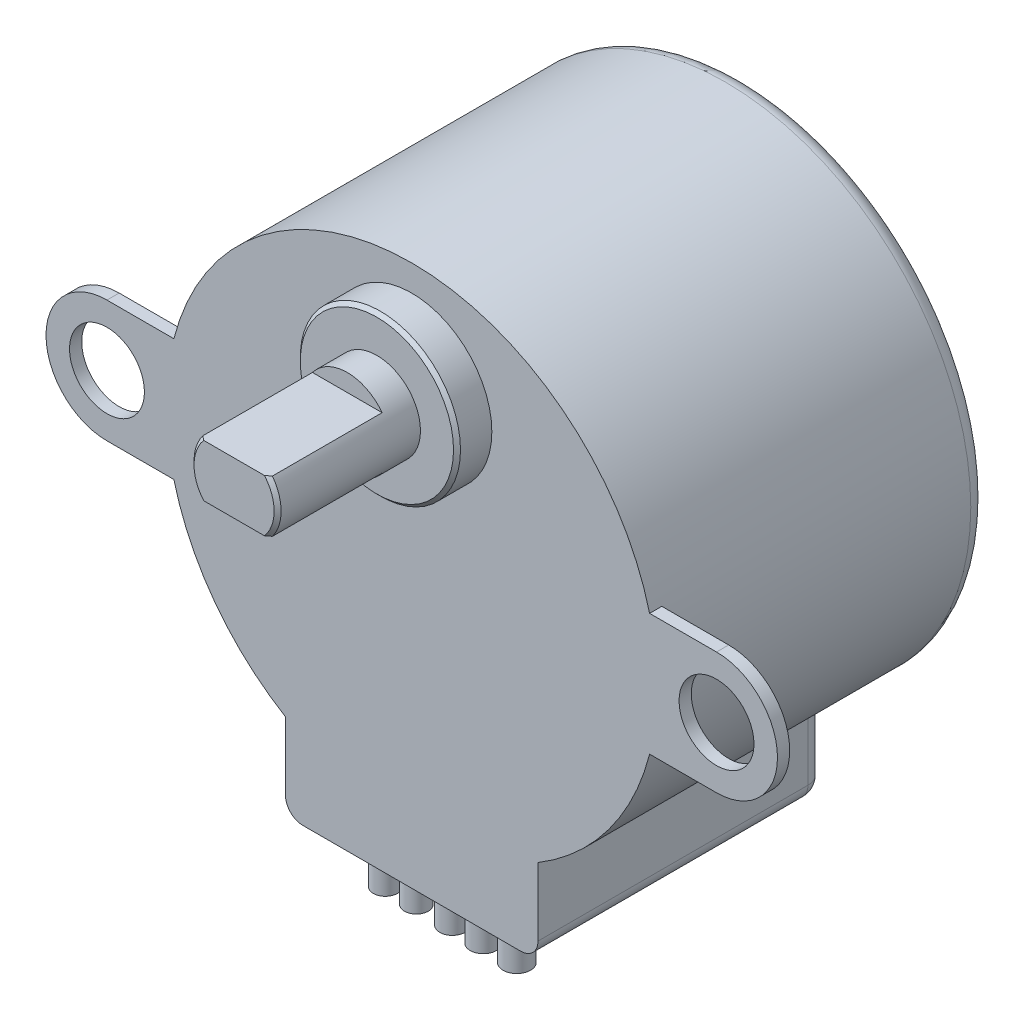
from build123d import *

# Parameters (mm, degrees)
SKETCH_1_R          = 14.1
EXTRUDE_1_DEPTH     = 19
SKETCH_2_R          = 2.15
EXTRUDE_2_DEPTH     = 0.7
FILLET_1_R          = 1
SKETCH_3_R          = 4.6
EXTRUDE_3_DEPTH     = 2
SKETCH_4_R          = 2.5
EXTRUDE_4_DEPTH     = 8.2
CUT_EXTRUDE_START   = -6.5
CUT_EXTRUDE_1_DEPTH = 6.5
CHAMFER_1_SIZE      = 0.2
EXTRUDE_START       = -16.5
EXTRUDE_5_DEPTH     = 16.5
FILLET_2_R          = 1
SKETCH_7_R          = 0.693296655
SKETCH_7_R_2        = 0.683224013
SKETCH_7_R_3        = 0.721072107
SKETCH_7_R_4        = 0.752437583
SKETCH_7_R_5        = 0.788430792
EXTRUDE_6_DEPTH     = 3


with BuildPart() as part:
    # 草图1 → 凸台-拉伸1 (new body)
    with BuildSketch(Plane.XY):
        Circle(SKETCH_1_R)
    extrude(amount=EXTRUDE_1_DEPTH)

    # 草图2 → 凸台-拉伸2 (add)
    with BuildSketch(Plane.XY.offset(19)):
        with BuildLine():
            Line((-17.5, 3.5), (17.5, 3.5))
            ThreePointArc((17.5, 3.5), (21, 0), (17.5, -3.5))
            Line((17.5, -3.5), (-17.5, -3.5))
            ThreePointArc((-17.5, -3.5), (-21, 0), (-17.5, 3.5))
        make_face()
        with Locations((-17.5, 0)):
            Circle(SKETCH_2_R, mode=Mode.SUBTRACT)
        with Locations((17.5, 0)):
            Circle(SKETCH_2_R, mode=Mode.SUBTRACT)
    extrude(amount=-EXTRUDE_2_DEPTH)

    # 圆角1
    fillet_1_edges = [part.edges().sort_by_distance(p)[0] for p in [
        (-14.1, 0, 0),
    ]]
    fillet(fillet_1_edges, radius=FILLET_1_R)

    # 草图3 → 凸台-拉伸3 (add)
    with BuildSketch(Plane.XY.offset(19)):
        with Locations((0, 8)):
            Circle(SKETCH_3_R)
    extrude(amount=EXTRUDE_3_DEPTH)

    # 草图4 → 凸台-拉伸4 (add)
    with BuildSketch(Plane.XY.offset(21)):
        with Locations((0, 8)):
            Circle(SKETCH_4_R)
    extrude(amount=EXTRUDE_4_DEPTH)

    # 草图5 → 切除-拉伸1 (cut)
    with BuildSketch(Plane.XY.offset(29.2).offset(CUT_EXTRUDE_START)):
        with BuildLine():
            Line((-2, 9.5), (2, 9.5))
            ThreePointArc((2, 9.5), (0, 10.5), (-2, 9.5))
        make_face()
        with BuildLine():
            Line((-2, 6.5), (2, 6.5))
            ThreePointArc((2, 6.5), (0, 5.5), (-2, 6.5))
        make_face()
    extrude(amount=CUT_EXTRUDE_1_DEPTH, mode=Mode.SUBTRACT)

    # 倒角1
    chamfer_1_edges = [part.edges().sort_by_distance(p)[0] for p in [
        (2.371708245, 8.790569415, 29.2),
        (-2.5, 8, 29.2),
        (-4.6, 8, 21),
    ]]
    chamfer(chamfer_1_edges, length=CHAMFER_1_SIZE)

    # 草图6 → 凸台-拉伸5 (add)
    with BuildSketch(Plane.XY.offset(19).offset(EXTRUDE_START)):
        with BuildLine():
            Line((-7.25, -12.09328326), (-7.25, -17))
            Line((-7.25, -17), (7.25, -17))
            Line((7.25, -17), (7.25, -12.09328326))
            ThreePointArc((7.25, -12.09328326), (0, -14.1), (-7.25, -12.09328326))
        make_face()
    extrude(amount=EXTRUDE_5_DEPTH)

    # 圆角2
    fillet_2_edges = [part.edges().sort_by_distance(p)[0] for p in [
        (7.25, -17, 10.75),
        (7.25, -14.54664163, 2.5),
        (0, -17, 2.5),
        (-7.25, -17, 10.75),
        (-7.25, -14.54664163, 2.5),
    ]]
    fillet(fillet_2_edges, radius=FILLET_2_R)

    # 草图7 → 凸台-拉伸6 (add)
    with BuildSketch(Plane.XZ.offset(17)):
        with Locations((-3.845717905, 16.667073374)):
            Circle(SKETCH_7_R)
        with Locations((-2.067073374, 16.667073374)):
            Circle(SKETCH_7_R_2)
        with Locations((0, 16.667073374)):
            Circle(SKETCH_7_R_3)
        with Locations((1.778644531, 16.667073374)):
            Circle(SKETCH_7_R_4)
        with Locations((3.701503484, 16.667073374)):
            Circle(SKETCH_7_R_5)
    extrude(amount=EXTRUDE_6_DEPTH)


solid = part.part
